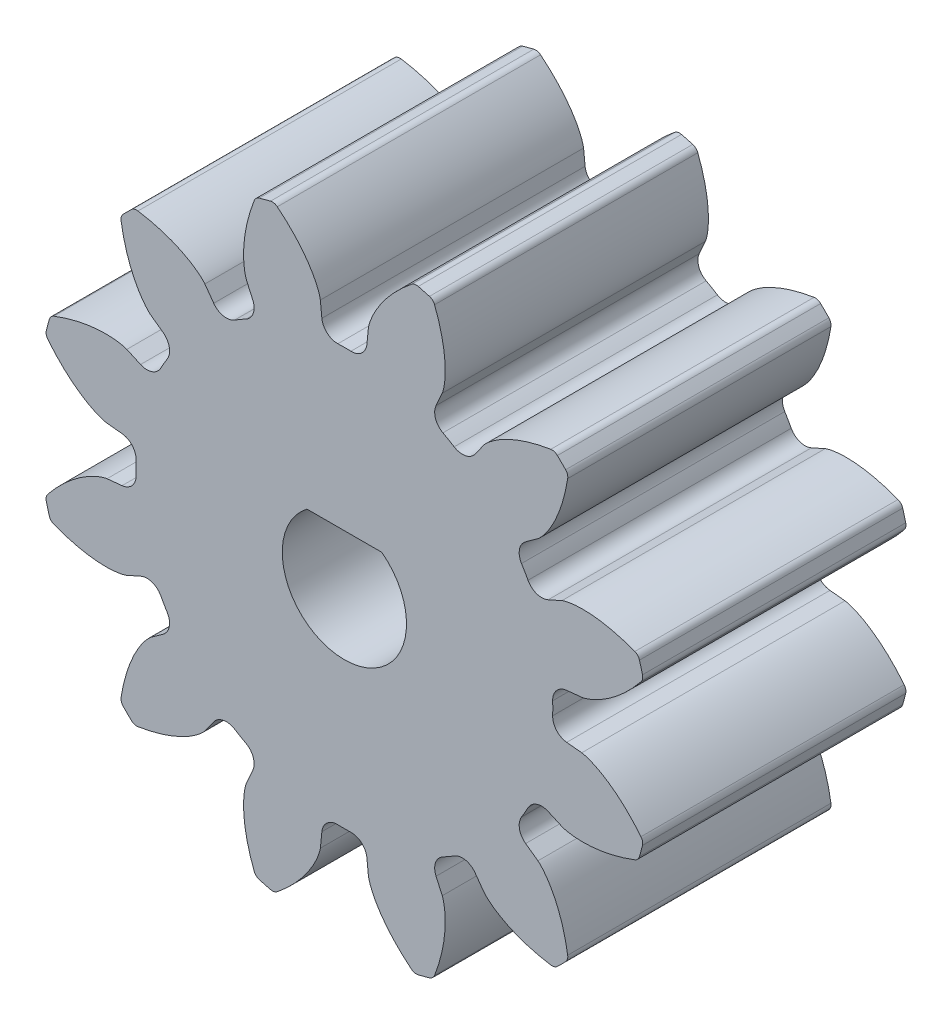
from build123d import *

# Parameters (mm, degrees)
SKETCH1_R                                 = 14.816666667
BOSS_EXTRUDE1_DEPTH                       = 12.7
CUT_EXTRUDE_DCLTBC_DEPTH                  = 25.502188111
FILLET_TIP_DCLTBC_R                       = 0.376401082
FILLET_ROOT_DCLTBC_R                      = 0.752802164
CIRPATTERN_DCLTBC_COUNT                   = 12
FILLET_TIP_DCLTBC_OF_CIRPATTERN_DCLTBC_R  = 0.376401082
FILLET_ROOT_DCLTBC_OF_CIRPATTERN_DCLTBC_R = 0.752802164
CUT_EXTRUDE5_DEPTH                        = 25.4


with BuildPart() as part:
    # Sketch1 → Boss-Extrude1 (new body)
    with BuildSketch(Plane.XY):
        Circle(SKETCH1_R)
    extrude(amount=BOSS_EXTRUDE1_DEPTH)

    # DCLTBC → Cut-Extrude-DCLTBC (cut, through all)
    with BuildSketch(Plane.XY):
        with BuildLine():
            Line((-1.159679207, 11.451539238), (-1.012988507, 10.003005631))
            ThreePointArc((-1.012988507, 10.003005631), (0, 10.054166667), (1.012988507, 10.003005631))
            Line((1.012988507, 10.003005631), (1.159679207, 11.451539238))
            add(Edge.make_bspline(
                [(1.159679207, 11.451539238), (1.160337964, 11.457092478), (1.162480311, 11.472631127), (1.16769301, 11.501852629), (1.177840848, 11.54925506), (1.1931747, 11.609197723), (1.21573605, 11.686066999), (1.245818813, 11.775761095), (1.282522681, 11.873332486), (1.326352157, 11.978305592), (1.373497508, 12.081909898), (1.423679567, 12.18414424), (1.476494051, 12.284932541), (1.543771073, 12.405699193), (1.629012992, 12.548625234), (1.735198724, 12.712740443), (1.86328375, 12.895246432), (2.001834622, 13.077104839), (2.144700841, 13.252557922), (2.296370835, 13.425560045), (2.448300114, 13.589903271), (2.613368384, 13.755933092), (2.769451673, 13.906830615), (2.95211403, 14.070449823), (3.101823771, 14.200925446), (3.262800626, 14.330996333), (3.342073731, 14.39359933), (3.382973257, 14.425293864)],
                knots=[0, 0, 0, 0, 0, 0.005376749, 0.015083688, 0.02853182, 0.046610139, 0.064854849, 0.092110525, 0.119476176, 0.146842496, 0.174208854, 0.201574955, 0.228941013, 0.256307345, 0.307035032, 0.361767352, 0.41649966, 0.471231936, 0.525964282, 0.580696615, 0.635428982, 0.690161387, 0.744893688, 0.799626082, 0.854358408, 0.909090915, 0.909090915, 0.909090915, 0.909090915, 0.909090915], degree=4))
            ThreePointArc((3.382973257, 14.425293864), (0, 14.816666667), (-3.382973257, 14.425293864))
            add(Edge.make_bspline(
                [(-1.159679207, 11.451539238), (-1.160337964, 11.457092478), (-1.162480311, 11.472631127), (-1.16769301, 11.501852629), (-1.177840848, 11.54925506), (-1.1931747, 11.609197723), (-1.21573605, 11.686066999), (-1.245818813, 11.775761095), (-1.282522681, 11.873332486), (-1.326352157, 11.978305592), (-1.373497508, 12.081909898), (-1.423679567, 12.18414424), (-1.476494051, 12.284932541), (-1.543771073, 12.405699193), (-1.629012992, 12.548625234), (-1.735198724, 12.712740443), (-1.86328375, 12.895246432), (-2.001834622, 13.077104839), (-2.144700841, 13.252557922), (-2.296370835, 13.425560045), (-2.448300114, 13.589903271), (-2.613368384, 13.755933092), (-2.769451673, 13.906830615), (-2.95211403, 14.070449823), (-3.101823771, 14.200925446), (-3.262800626, 14.330996333), (-3.342073731, 14.39359933), (-3.382973257, 14.425293864)],
                knots=[0, 0, 0, 0, 0, 0.005376749, 0.015083688, 0.02853182, 0.046610139, 0.064854849, 0.092110525, 0.119476176, 0.146842496, 0.174208854, 0.201574955, 0.228941013, 0.256307345, 0.307035032, 0.361767352, 0.41649966, 0.471231936, 0.525964282, 0.580696615, 0.635428982, 0.690161387, 0.744893688, 0.799626082, 0.854358408, 0.909090915, 0.909090915, 0.909090915, 0.909090915, 0.909090915], degree=4))
        make_face()
    cut_extrude_dcltbc = extrude(amount=CUT_EXTRUDE_DCLTBC_DEPTH, mode=Mode.SUBTRACT)

    # Fillet-Tip-DCLTBC
    fillet_tip_dcltbc_edges = [part.edges().sort_by_distance(p)[0] for p in [
        (3.382973257, 14.425293864, 6.35),
        (-3.382973257, 14.425293864, 6.35),
    ]]
    fillet(fillet_tip_dcltbc_edges, radius=FILLET_TIP_DCLTBC_R)

    # Fillet-Root-DCLTBC
    fillet_root_dcltbc_edges = [part.edges().sort_by_distance(p)[0] for p in [
        (-1.012988507, 10.003005631, 6.35),
        (1.012988507, 10.003005631, 6.35),
    ]]
    fillet(fillet_root_dcltbc_edges, radius=FILLET_ROOT_DCLTBC_R)

    # CirPattern-DCLTBC: Cut-Extrude-DCLTBC ×12 about axis
    cirpattern_dcltbc_axis = Axis((0, 0, 12.7), (0, 0, 1))
    for i in range(1, CIRPATTERN_DCLTBC_COUNT):
        add(cut_extrude_dcltbc.rotate(cirpattern_dcltbc_axis, i * 360 / CIRPATTERN_DCLTBC_COUNT), mode=Mode.SUBTRACT)

    # Fillet-Tip-DCLTBC of CirPattern-DCLTBC
    fillet_tip_dcltbc_of_cirpattern_dcltbc_edges = [part.edges().sort_by_distance(p)[0] for p in [
        (-4.282906151, 14.184157571, 6.35),
        (-10.142387713, 10.801184315, 6.35),
        (-10.801184315, 10.142387713, 6.35),
        (-14.184157571, 4.282906151, 6.35),
        (-14.425293864, 3.382973257, 6.35),
        (-14.425293864, -3.382973257, 6.35),
        (-14.184157571, -4.282906151, 6.35),
        (-10.801184315, -10.142387713, 6.35),
        (-10.142387713, -10.801184315, 6.35),
        (-4.282906151, -14.184157571, 6.35),
        (-3.382973257, -14.425293864, 6.35),
        (3.382973257, -14.425293864, 6.35),
        (4.282906151, -14.184157571, 6.35),
        (10.142387713, -10.801184315, 6.35),
        (10.801184315, -10.142387713, 6.35),
        (14.184157571, -4.282906151, 6.35),
        (14.425293864, -3.382973257, 6.35),
        (14.425293864, 3.382973257, 6.35),
        (14.184157571, 4.282906151, 6.35),
        (10.801184315, 10.142387713, 6.35),
        (10.142387713, 10.801184315, 6.35),
        (4.282906151, 14.184157571, 6.35),
    ]]
    fillet(fillet_tip_dcltbc_of_cirpattern_dcltbc_edges, radius=FILLET_TIP_DCLTBC_OF_CIRPATTERN_DCLTBC_R)

    # Fillet-Root-DCLTBC of CirPattern-DCLTBC
    fillet_root_dcltbc_of_cirpattern_dcltbc_edges = [part.edges().sort_by_distance(p)[0] for p in [
        (-5.878776596, 8.156362737, 6.35),
        (-4.124229035, 9.169351244, 6.35),
        (-9.169351244, 4.124229035, 6.35),
        (-8.156362737, 5.878776596, 6.35),
        (-10.003005631, -1.012988507, 6.35),
        (-10.003005631, 1.012988507, 6.35),
        (-8.156362737, -5.878776596, 6.35),
        (-9.169351244, -4.124229035, 6.35),
        (-4.124229035, -9.169351244, 6.35),
        (-5.878776596, -8.156362737, 6.35),
        (1.012988507, -10.003005631, 6.35),
        (-1.012988507, -10.003005631, 6.35),
        (5.878776596, -8.156362737, 6.35),
        (4.124229035, -9.169351244, 6.35),
        (9.169351244, -4.124229035, 6.35),
        (8.156362737, -5.878776596, 6.35),
        (10.003005631, 1.012988507, 6.35),
        (10.003005631, -1.012988507, 6.35),
        (8.156362737, 5.878776596, 6.35),
        (9.169351244, 4.124229035, 6.35),
        (4.124229035, 9.169351244, 6.35),
        (5.878776596, 8.156362737, 6.35),
    ]]
    fillet(fillet_root_dcltbc_of_cirpattern_dcltbc_edges, radius=FILLET_ROOT_DCLTBC_OF_CIRPATTERN_DCLTBC_R)

    # Sketch8 → Cut-Extrude5 (cut)
    with BuildSketch(Plane.XY):
        with BuildLine():
            Line((1.8034, 2.393941578), (-1.8034, 2.393941578))
            ThreePointArc((-1.8034, 2.393941578), (-1.337545767, -2.682196704), (2.9972, 0))
            ThreePointArc((2.9972, 0), (2.682196704, 1.337545767), (1.8034, 2.393941578))
        make_face()
    extrude(amount=CUT_EXTRUDE5_DEPTH, mode=Mode.SUBTRACT)


solid = part.part
